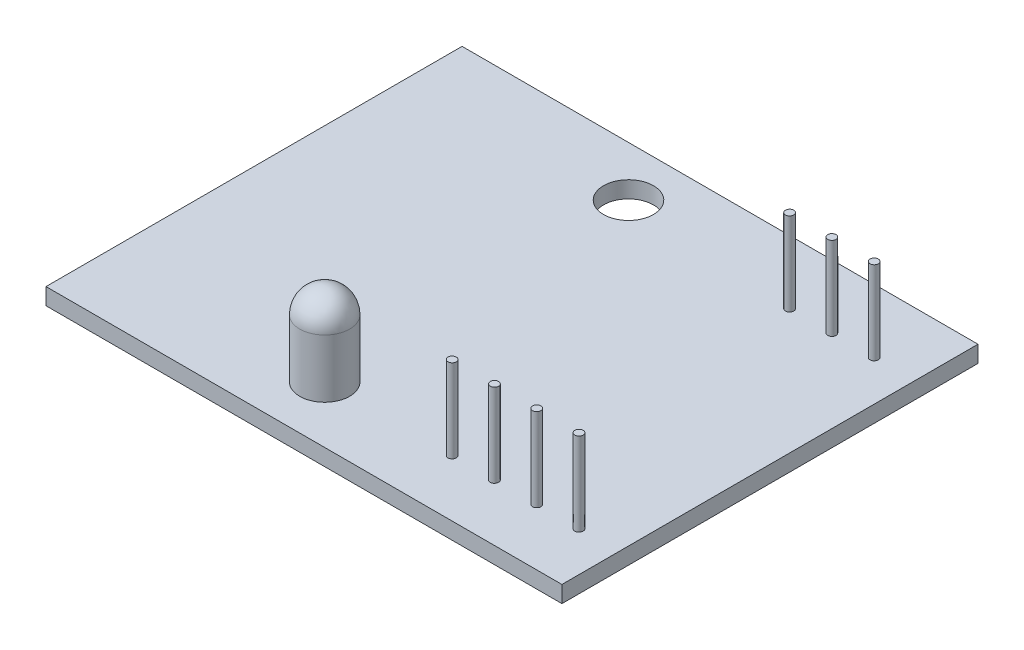
from build123d import *

# Parameters (mm, degrees)
SKICA1_W                  = 31
SKICA1_H                  = 25
P_IDAT_VYSUNUT_M1_DEPTH   = 1
P_IDAT_VYSUNUT_M2_DEPTH   = 6
SKICA3_W                  = 5
SKICA3_H                  = 5
ODEBRAT_VYSUNUT_M1_DEPTH  = 0.5
SKICA4_R                  = 1.5
ODEBRAT_VYSUNUT_M2_DEPTH  = 41.274061131
ZKOSEN_1_SIZE             = 0.3
SKICA5_R                  = 0.25
P_IDAT_VYSUNUT_M3_DEPTH   = 5
P_IDAT_VYSUNUT_M3_2_DEPTH = 5
P_IDAT_VYSUNUT_M3_3_DEPTH = 5
P_IDAT_VYSUNUT_M3_4_DEPTH = 5
P_IDAT_VYSUNUT_M3_5_DEPTH = 5
P_IDAT_VYSUNUT_M3_6_DEPTH = 5
P_IDAT_VYSUNUT_M3_7_DEPTH = 5
SKICA7_R                  = 0.25
P_IDAT_VYSUNUT_M5_DEPTH   = 0.5
SKICA6_R                  = 1.5
P_IDAT_VYSUNUT_M4_DEPTH   = 5
ZAOBLIT1_R                = 1.5


with BuildPart() as part:
    # Skica1 → Přidat vysunutím1 (new body)
    with BuildSketch(Plane(origin=(0, 0, 0), x_dir=(1, 0, 0), z_dir=(0, 1, 0))):
        with Locations((15.5, 12.5)):
            Rectangle(SKICA1_W, SKICA1_H)
    extrude(amount=P_IDAT_VYSUNUT_M1_DEPTH)

    # Skica4 → Odebrat vysunutím2 (cut, through all)
    with BuildSketch(Plane.XZ):
        with Locations((13, -22)):
            Circle(SKICA4_R)
    extrude(amount=-ODEBRAT_VYSUNUT_M2_DEPTH, mode=Mode.SUBTRACT)



with BuildPart() as body_2:
    # Skica2 → Přidat vysunutím2 (new body)
    with BuildSketch(Plane.XZ):
        Polygon((1.5, -11.5), (1.5, -14.75), (2, -14.75), (2, -15.25), (1.5, -15.25), (1.5, -18.5), (8.5, -18.5), (8.5, -15.25), (8, -15.25), (8, -14.75), (8.5, -14.75), (8.5, -11.5), align=None)
    extrude(amount=P_IDAT_VYSUNUT_M2_DEPTH)

    # Skica3 → Odebrat vysunutím1 (cut)
    with BuildSketch(Plane.XZ.offset(6)):
        with Locations((5, -15)):
            Rectangle(SKICA3_W, SKICA3_H)
    extrude(amount=-ODEBRAT_VYSUNUT_M1_DEPTH, mode=Mode.SUBTRACT)

    # Zkosení1
    zkosen_1_edges = [body_2.edges().sort_by_distance(p)[0] for p in [
        (8.5, -6, -16.875),
        (5, -6, -18.5),
        (1.5, -6, -16.875),
        (8.5, -6, -13.125),
        (5, -6, -11.5),
        (1.5, -6, -13.125),
    ]]
    chamfer(zkosen_1_edges, length=ZKOSEN_1_SIZE)


with BuildPart() as body_3:
    # Skica5 → Přidat vysunutím3 (new body)
    with BuildSketch(Plane(origin=(0, 1, 0), x_dir=(1, 0, 0), z_dir=(0, 1, 0))):
        with Locations((20.995, 3.41)):
            Circle(SKICA5_R)
    extrude(amount=P_IDAT_VYSUNUT_M3_DEPTH)


with BuildPart() as body_4:
    # Skica5 → P_idat vysunut_m3 2 (new body)
    with BuildSketch(Plane(origin=(0, 1, 0), x_dir=(1, 0, 0), z_dir=(0, 1, 0))):
        with Locations((23.535, 3.41)):
            Circle(SKICA5_R)
    extrude(amount=P_IDAT_VYSUNUT_M3_2_DEPTH)


with BuildPart() as body_5:
    # Skica5 → P_idat vysunut_m3 3 (new body)
    with BuildSketch(Plane(origin=(0, 1, 0), x_dir=(1, 0, 0), z_dir=(0, 1, 0))):
        with Locations((26.075, 3.41)):
            Circle(SKICA5_R)
    extrude(amount=P_IDAT_VYSUNUT_M3_3_DEPTH)


with BuildPart() as body_6:
    # Skica5 → P_idat vysunut_m3 4 (new body)
    with BuildSketch(Plane(origin=(0, 1, 0), x_dir=(1, 0, 0), z_dir=(0, 1, 0))):
        with Locations((28.615, 3.41)):
            Circle(SKICA5_R)
    extrude(amount=P_IDAT_VYSUNUT_M3_4_DEPTH)


with BuildPart() as body_7:
    # Skica5 → P_idat vysunut_m3 5 (new body)
    with BuildSketch(Plane(origin=(0, 1, 0), x_dir=(1, 0, 0), z_dir=(0, 1, 0))):
        with Locations((28.57, 21.19)):
            Circle(SKICA5_R)
    extrude(amount=P_IDAT_VYSUNUT_M3_5_DEPTH)


with BuildPart() as body_8:
    # Skica5 → P_idat vysunut_m3 6 (new body)
    with BuildSketch(Plane(origin=(0, 1, 0), x_dir=(1, 0, 0), z_dir=(0, 1, 0))):
        with Locations((26.03, 21.19)):
            Circle(SKICA5_R)
    extrude(amount=P_IDAT_VYSUNUT_M3_6_DEPTH)


with BuildPart() as body_9:
    # Skica5 → P_idat vysunut_m3 7 (new body)
    with BuildSketch(Plane(origin=(0, 1, 0), x_dir=(1, 0, 0), z_dir=(0, 1, 0))):
        with Locations((23.49, 21.19)):
            Circle(SKICA5_R)
    extrude(amount=P_IDAT_VYSUNUT_M3_7_DEPTH)


with BuildPart() as part_1:
    add(part.part)

    add(body_3.part)  # Přidat vysunutím5 merges body 3

    add(body_4.part)  # Přidat vysunutím5 merges body 4

    add(body_5.part)  # Přidat vysunutím5 merges body 5

    add(body_6.part)  # Přidat vysunutím5 merges body 6

    add(body_7.part)  # Přidat vysunutím5 merges body 7

    add(body_8.part)  # Přidat vysunutím5 merges body 8

    add(body_9.part)  # Přidat vysunutím5 merges body 9
    # Skica7 → Přidat vysunutím5 (add)
    with BuildSketch(Plane(origin=(0, 1, 0), x_dir=(1, 0, 0), z_dir=(0, 1, 0))):
        with Locations((23.49, 21.19)):
            Circle(SKICA7_R)
        with Locations((26.03, 21.19)):
            Circle(SKICA7_R)
        with Locations((28.57, 21.19)):
            Circle(SKICA7_R)
        with Locations((20.995, 3.41)):
            Circle(SKICA7_R)
        with Locations((23.535, 3.41)):
            Circle(SKICA7_R)
        with Locations((26.075, 3.41)):
            Circle(SKICA7_R)
        with Locations((28.615, 3.41)):
            Circle(SKICA7_R)
    extrude(amount=P_IDAT_VYSUNUT_M5_DEPTH)

    # Skica6 → Přidat vysunutím4 (add)
    with BuildSketch(Plane(origin=(0, 1, 0), x_dir=(1, 0, 0), z_dir=(0, 1, 0))):
        with Locations((13.335, 3.41)):
            Circle(SKICA6_R)
    extrude(amount=P_IDAT_VYSUNUT_M4_DEPTH)

    # Zaoblit1
    zaoblit1_edges = [part_1.edges().sort_by_distance(p)[0] for p in [
        (11.835, 6, -3.41),
    ]]
    fillet(zaoblit1_edges, radius=ZAOBLIT1_R)


solid = Compound([body_2.part, part_1.part])
